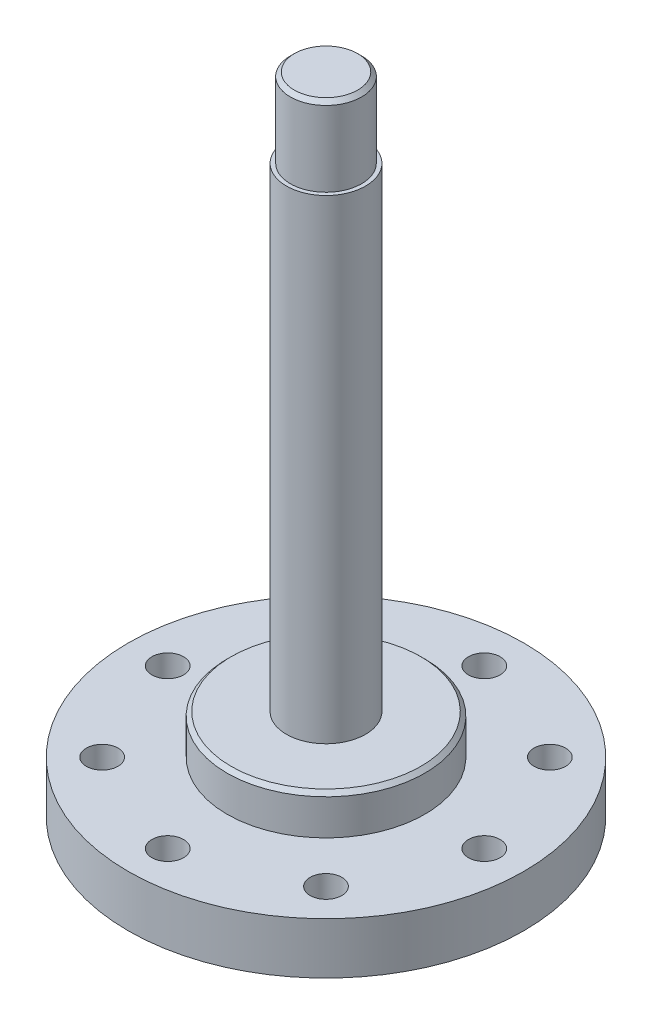
from build123d import *

# Parameters (mm, degrees)
CHAMFER1_SIZE            = 1
CHAMFER2_SIZE            = 1
SKETCH3_R                = 4
CUT_EXTRUDE1_DEPTH       = 178.676672639
CUT_EXTRUDE2_START       = -3
CUT_EXTRUDE2_DEPTH       = 14
BOSS_EXTRUDE1_REACH      = 181.148
BOSS_EXTRUDE1_END_RADIUS = 9


with BuildPart() as part:
    # Sketch2 → Revolve1 (revolve)
    with BuildSketch(Plane(origin=(0, 0, 0), x_dir=(0, 0, -1), z_dir=(1, 0, 0))):
        Polygon((0, 0), (50, 0), (50, 13), (25, 13), (25, 23), (10, 23), (10, 143), (9, 143), (9, 163), (0, 163), align=None)
    revolve(axis=Axis((0, 0, 0), (0, 1, 0)))

    # Chamfer1
    chamfer1_edges = [part.edges().sort_by_distance(p)[0] for p in [
        (0, 163, 9),
    ]]
    chamfer(chamfer1_edges, length=CHAMFER1_SIZE)

    # Chamfer2
    chamfer2_edges = [part.edges().sort_by_distance(p)[0] for p in [
        (0, 23, 25),
    ]]
    chamfer(chamfer2_edges, length=CHAMFER2_SIZE)

    # Sketch3 → Cut-Extrude1 (cut, through all)
    with BuildSketch(Plane.XZ):
        with Locations((40, 0)):
            Circle(SKETCH3_R)
        with Locations((28.284271247, 28.284271247)):
            Circle(SKETCH3_R)
        with Locations((28.284271247, -28.284271247)):
            Circle(SKETCH3_R)
        with Locations((0, 40)):
            Circle(SKETCH3_R)
        with Locations((0, -40)):
            Circle(SKETCH3_R)
        with Locations((-28.284271247, 28.284271247)):
            Circle(SKETCH3_R)
        with Locations((-28.284271247, -28.284271247)):
            Circle(SKETCH3_R)
        with Locations((-40, 0)):
            Circle(SKETCH3_R)
    extrude(amount=-CUT_EXTRUDE1_DEPTH, mode=Mode.SUBTRACT)

    # Sketch5 → Cut-Extrude2 (cut)
    with BuildSketch(Plane(origin=(0, 163, 0), x_dir=(1, 0, 0), z_dir=(0, 1, 0)).offset(CUT_EXTRUDE2_START)):
        with BuildLine():
            Line((-3, 5), (3, 5))
            Line((3, 5), (3, 8.485281374))
            ThreePointArc((3, 8.485281374), (0, 9), (-3, 8.485281374))
            Line((-3, 8.485281374), (-3, 5))
        make_face()
    extrude(amount=-CUT_EXTRUDE2_DEPTH, mode=Mode.SUBTRACT)

    # Boss-Extrude1: up to this cylinder (the profile starts inside it)
    boss_extrude1_end = Plane(origin=(0, 153, 0), z_dir=(0, -1, 0)) * Cylinder(BOSS_EXTRUDE1_END_RADIUS, 381.296, mode=Mode.PRIVATE)
    # Sketch6 → Boss-Extrude1 (add, up to the surface)
    with BuildSketch(Plane(origin=(0, 0, -5), x_dir=(-1, 0, 0), z_dir=(0, 0, -1)), mode=Mode.PRIVATE) as boss_extrude1_sk1:
        with BuildLine():
            ThreePointArc((-2, 158), (-1.414213562, 159.414213562), (0, 160))
            Line((0, 160), (-3, 160))
            Line((-3, 160), (-3, 146))
            Line((-3, 146), (0, 146))
            ThreePointArc((0, 146), (-1.414213562, 146.585786438), (-2, 148))
            Line((-2, 148), (-2, 158))
        make_face()
    boss_extrude1_tool1 = extrude(boss_extrude1_sk1.sketch, amount=BOSS_EXTRUDE1_REACH, mode=Mode.PRIVATE) & boss_extrude1_end
    add(boss_extrude1_tool1.solids().sort_by_distance((2.396584, 153, -5))[0])
    # Sketch6 → Boss-Extrude1 (add, up to the surface)
    with BuildSketch(Plane(origin=(0, 0, -5), x_dir=(-1, 0, 0), z_dir=(0, 0, -1)), mode=Mode.PRIVATE) as boss_extrude1_sk2:
        with BuildLine():
            Line((3, 160), (0, 160))
            ThreePointArc((0, 160), (1.414213562, 159.414213562), (2, 158))
            Line((2, 158), (2, 148))
            ThreePointArc((2, 148), (1.414213562, 146.585786438), (0, 146))
            Line((0, 146), (3, 146))
            Line((3, 146), (3, 160))
        make_face()
    boss_extrude1_tool2 = extrude(boss_extrude1_sk2.sketch, amount=BOSS_EXTRUDE1_REACH, mode=Mode.PRIVATE) & boss_extrude1_end
    add(boss_extrude1_tool2.solids().sort_by_distance((-2.396584, 153, -5))[0])


solid = part.part
